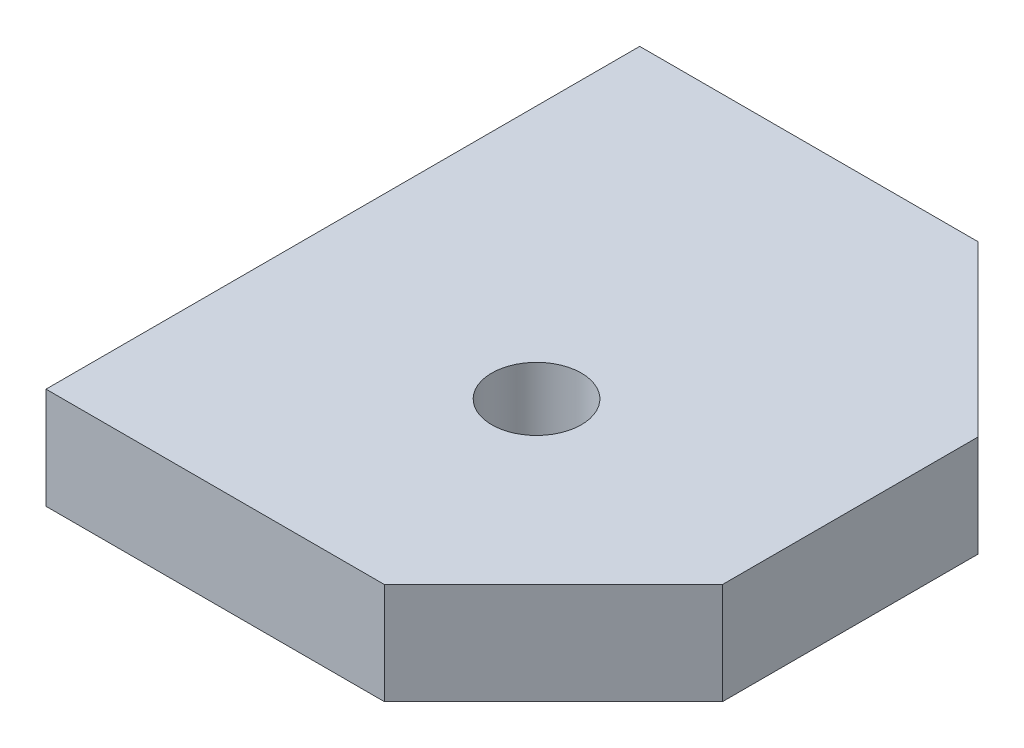
from build123d import *

# Parameters (mm, degrees)
SKETCH1_W            = 30
SKETCH1_H            = 35.1
BOSS_EXTRUDE1_DEPTH  = 6
CHAMFER1_SIZE        = 10
M5_CLEARANCE_HOLE1_D = 5.3


with BuildPart() as part:
    # Sketch1 → Boss-Extrude1 (new body)
    with BuildSketch(Plane(origin=(0, 0, 0), x_dir=(1, 0, 0), z_dir=(0, 1, 0))):
        with Locations((15, 17.55)):
            Rectangle(SKETCH1_W, SKETCH1_H)
    extrude(amount=BOSS_EXTRUDE1_DEPTH)

    # Chamfer1
    chamfer1_edges = [part.edges().sort_by_distance(p)[0] for p in [
        (30, 3, -35.1),
        (30, 3, 0),
    ]]
    chamfer(chamfer1_edges, length=CHAMFER1_SIZE)

    # M5 Clearance Hole1 (through all)
    with Locations(Plane(origin=(0, 0, 0), x_dir=(-1, 0, 0), z_dir=(0, -1, 0))):
        with Locations((-15, 14)):
            Hole(M5_CLEARANCE_HOLE1_D / 2)


solid = part.part
